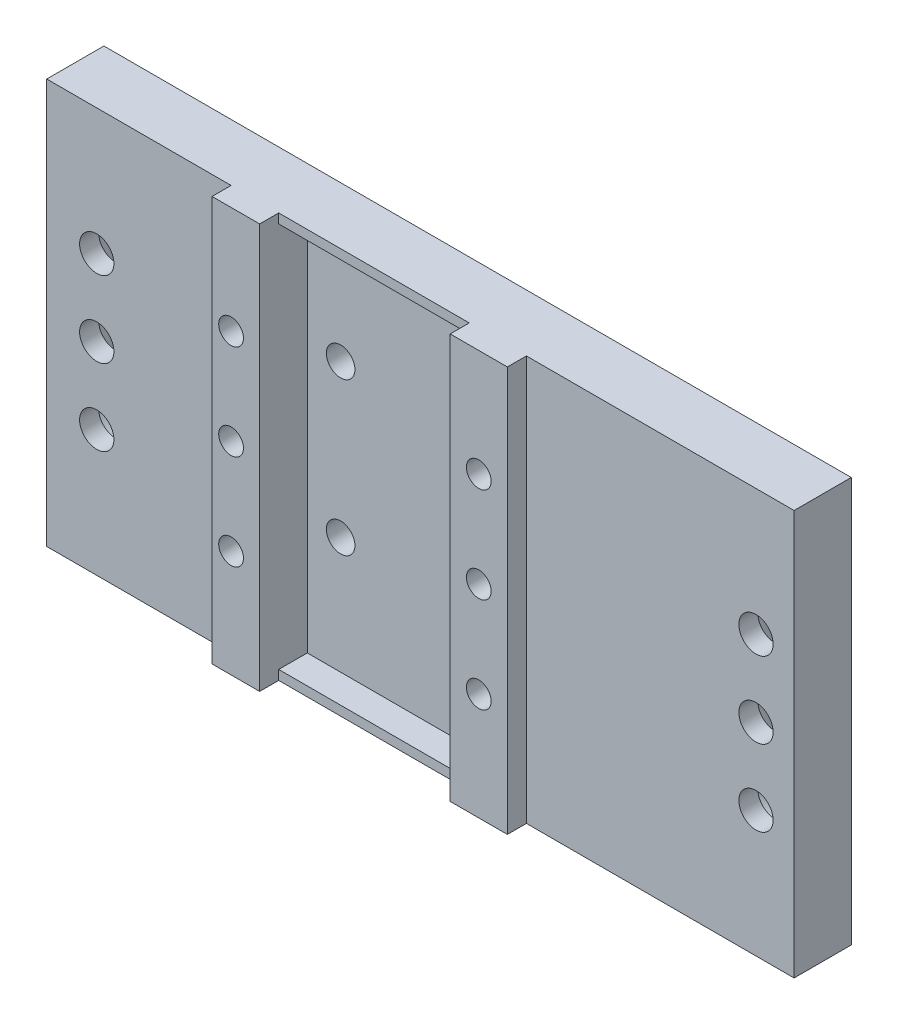
from build123d import *

# Parameters (mm, degrees)
EXTRUDE_1_DEPTH         = 42.5
SKETCH_2_W              = 20
SKETCH_2_H              = 40.5
CUT_EXTRUDE_2_DEPTH     = 3
SKETCH_4_R              = 1.5
CUT_EXTRUDE_4_DEPTH     = 4
CUT_EXTRUDE_START       = -6
SKETCH_5_R              = 1.8
CUT_EXTRUDE_5_DEPTH     = 6
SKETCH_6_R              = 1.8
CUT_EXTRUDE_6_DEPTH     = 6
CUT_EXTRUDE_START_2     = -4
CUT_EXTRUDE_9_OUTLINE_R = 1.8
CUT_EXTRUDE_9_DEPTH     = 4
SKETCH_8_R              = 1.3
CUT_EXTRUDE_10_DEPTH    = 16
EXTRUDE_2_DEPTH         = 2
SKETCH_10_R             = 1.3
CUT_EXTRUDE_11_DEPTH    = 16


# Read off the part's stored shape, not the designer's step: 除料-伸長9
with BuildPart() as part:
    # 草圖1 → 填料-伸長1 (new body)
    with BuildSketch(Plane(origin=(0, 0, 0), x_dir=(1, 0, 0), z_dir=(0, 1, 0))):
        Polygon((36, 0), (61.1, 0), (61.1, -6), (-17.35, -6), (-17.35, 0), (0, 0), align=None)
    extrude(amount=EXTRUDE_1_DEPTH)

    # 草圖2 → 除料-伸長2 (cut)
    with BuildSketch(Plane.XY.offset(6)):
        with Locations((17, 21.25)):
            Rectangle(SKETCH_2_W, SKETCH_2_H)
    extrude(amount=-CUT_EXTRUDE_2_DEPTH, mode=Mode.SUBTRACT)

    # 草圖4 → 除料-伸長4 (cut)
    with BuildSketch(Plane.XY.offset(3)):
        with Locations((23.5, 29.25)):
            Circle(SKETCH_4_R)
        with Locations((10.5, 29.25)):
            Circle(SKETCH_4_R)
        with Locations((10.5, 13.25)):
            Circle(SKETCH_4_R)
        with Locations((23.5, 13.25)):
            Circle(SKETCH_4_R)
    extrude(amount=-CUT_EXTRUDE_4_DEPTH, mode=Mode.SUBTRACT)

    # 草圖5 → 除料-伸長5 (cut)
    with BuildSketch(Plane(origin=(0, 0, 0), x_dir=(-1, 0, 0), z_dir=(0, 0, -1)).offset(CUT_EXTRUDE_START)):
        with Locations((12.1, 29.25)):
            Circle(SKETCH_5_R)
        with Locations((12.1, 21.25)):
            Circle(SKETCH_5_R)
        with Locations((12.1, 13.25)):
            Circle(SKETCH_5_R)
    extrude(amount=CUT_EXTRUDE_5_DEPTH, mode=Mode.SUBTRACT)

    # 草圖6 → 除料-伸長6 (cut)
    with BuildSketch(Plane(origin=(0, 0, 0), x_dir=(-1, 0, 0), z_dir=(0, 0, -1)).offset(CUT_EXTRUDE_START)):
        with Locations((-57.1, 29.25)):
            Circle(SKETCH_6_R)
        with Locations((-57.1, 21.25)):
            Circle(SKETCH_6_R)
        with Locations((-57.1, 13.25)):
            Circle(SKETCH_6_R)
    extrude(amount=CUT_EXTRUDE_6_DEPTH, mode=Mode.SUBTRACT)

    # 除料-伸長9 outline → 除料-伸長9 (cut)
    # profile 1 of 2: a face of its own
    with BuildSketch(Plane(origin=(0, 0, 0), x_dir=(-1, 0, 0), z_dir=(0, 0, -1)).offset(CUT_EXTRUDE_START_2)):
        with BuildLine():
            Line((-60.95, 29.25), (-60.95, 13.25))
            ThreePointArc((-60.95, 13.25), (-57.1, 9.4), (-53.25, 13.25))
            Line((-53.25, 13.25), (-53.25, 29.25))
            ThreePointArc((-53.25, 29.25), (-57.1, 33.1), (-60.95, 29.25))
        make_face()
        with Locations((-57.1, 13.25)):
            Circle(CUT_EXTRUDE_9_OUTLINE_R, mode=Mode.SUBTRACT)
        with Locations((-57.1, 21.25)):
            Circle(CUT_EXTRUDE_9_OUTLINE_R, mode=Mode.SUBTRACT)
        with Locations((-57.1, 29.25)):
            Circle(CUT_EXTRUDE_9_OUTLINE_R, mode=Mode.SUBTRACT)
    # profile 2 of 2: a face of its own
    with BuildSketch(Plane(origin=(0, 0, 0), x_dir=(-1, 0, 0), z_dir=(0, 0, -1)).offset(CUT_EXTRUDE_START_2)):
        with BuildLine():
            Line((8.1, 21.25), (8.155316246, 12.587074601))
            ThreePointArc((8.155316246, 12.587074601), (12.1, 9.25), (16.044683754, 12.587074601))
            Line((16.044683754, 12.587074601), (16.1, 21.25))
            Line((16.1, 21.25), (16.1, 29.25))
            ThreePointArc((16.1, 29.25), (12.1, 33.25), (8.1, 29.25))
            Line((8.1, 29.25), (8.1, 21.25))
        make_face()
        with Locations((12.1, 13.25)):
            Circle(CUT_EXTRUDE_9_OUTLINE_R, mode=Mode.SUBTRACT)
        with Locations((12.1, 21.25)):
            Circle(CUT_EXTRUDE_9_OUTLINE_R, mode=Mode.SUBTRACT)
        with Locations((12.1, 29.25)):
            Circle(CUT_EXTRUDE_9_OUTLINE_R, mode=Mode.SUBTRACT)
    extrude(amount=CUT_EXTRUDE_9_DEPTH, mode=Mode.SUBTRACT)

    # 草圖8 → 除料-伸長10 (cut)
    with BuildSketch(Plane(origin=(0, 0, 0), x_dir=(-1, 0, 0), z_dir=(0, 0, -1))):
        with Locations((-4, 31.25)):
            Circle(SKETCH_8_R)
        with Locations((-4, 21.25)):
            Circle(SKETCH_8_R)
        with Locations((-4, 11.25)):
            Circle(SKETCH_8_R)
        with Locations((-30, 11.25)):
            Circle(SKETCH_8_R)
        with Locations((-30, 21.25)):
            Circle(SKETCH_8_R)
        with Locations((-30, 31.25)):
            Circle(SKETCH_8_R)
    extrude(amount=-CUT_EXTRUDE_10_DEPTH, mode=Mode.SUBTRACT)

    # 草圖9 → 填料-伸長2 (add)
    with BuildSketch(Plane.XY.offset(6)):
        Polygon((7, 41.5), (7, 42.5), (2, 42.5), (2, 0), (7, 0), (7, 1), align=None)
        Polygon((27, 41.5), (27, 42.5), (33, 42.5), (33, 0), (27, 0), align=None)
    extrude(amount=EXTRUDE_2_DEPTH)

    # 草圖10 → 除料-伸長11 (cut)
    with BuildSketch(Plane(origin=(0, 0, 0), x_dir=(-1, 0, 0), z_dir=(0, 0, -1))):
        with Locations((-30, 31.25)):
            Circle(SKETCH_10_R)
        with Locations((-30, 21.25)):
            Circle(SKETCH_10_R)
        with Locations((-30, 11.25)):
            Circle(SKETCH_10_R)
        with Locations((-4, 11.25)):
            Circle(SKETCH_10_R)
        with Locations((-4, 21.25)):
            Circle(SKETCH_10_R)
        with Locations((-4, 31.25)):
            Circle(SKETCH_10_R)
    extrude(amount=-CUT_EXTRUDE_11_DEPTH, mode=Mode.SUBTRACT)


solid = part.part
